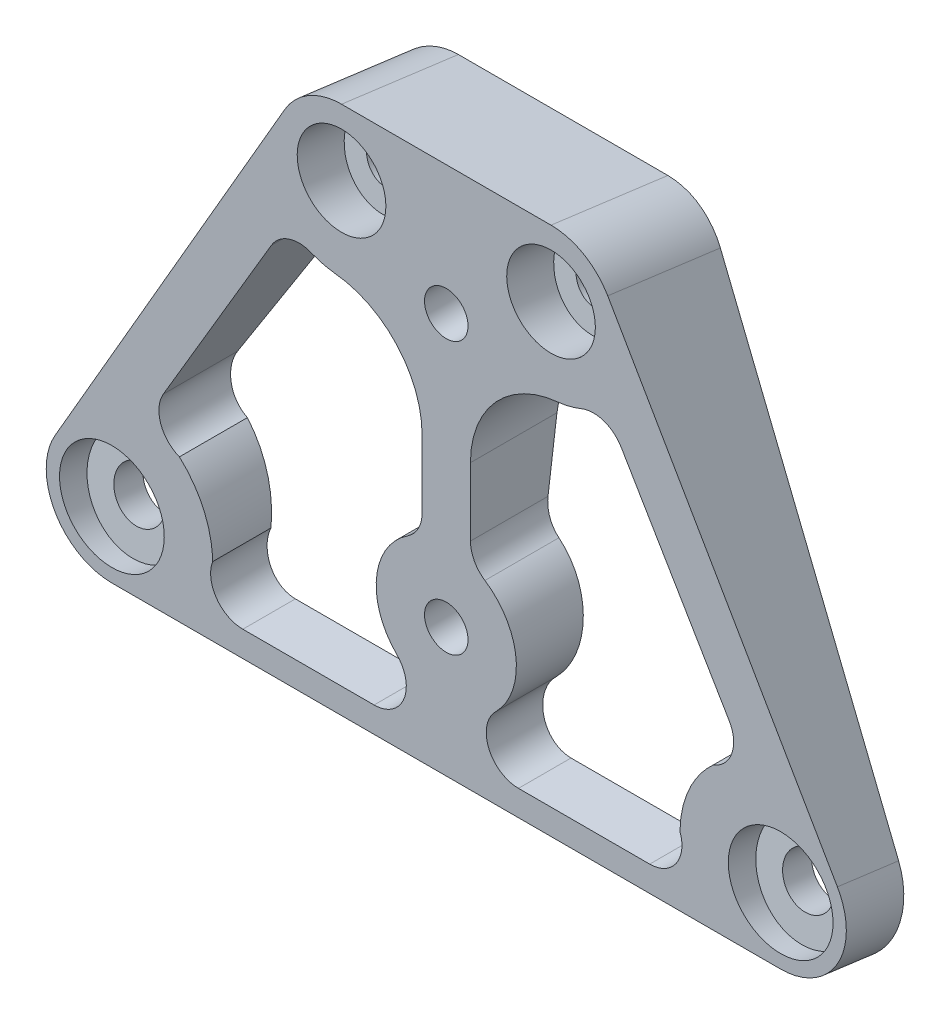
from build123d import *

# Parameters (mm, degrees)
BOSS_EXTRUDE1_REACH              = 47.134
SKETCH1_R                        = 1.375
SKETCH1_R_2                      = 1.575
CBORE_FOR_M3_SHCS1_D             = 3.2
CBORE_FOR_M3_SHCS1_CBORE_D       = 6.5
CBORE_FOR_M3_SHCS1_CBORE_DEPTH   = 5.5
CBORE_FOR_M2_5_SHCS2_D           = 2.7
CBORE_FOR_M2_5_SHCS2_CBORE_D     = 5.5
CBORE_FOR_M2_5_SHCS2_CBORE_DEPTH = 3.5
CBORE_FOR_M2_5_SHCS1_D           = 2.7
CBORE_FOR_M2_5_SHCS1_CBORE_D     = 5.5
CBORE_FOR_M2_5_SHCS1_CBORE_DEPTH = 5
CUT_EXTRUDE2_DEPTH               = 43.124845356


with BuildPart() as part:
    # Boss-Extrude1: up to this plane
    boss_extrude1_end = Plane(origin=(0, 0, 3), z_dir=(0, 0, 1))
    # Sketch1 → Boss-Extrude1 (new, up to the surface)
    with BuildSketch(Plane(origin=(0, 0, 0), x_dir=(1, 0, 0), z_dir=(0, 0.13052619222005188, 0.9914448613738104)), mode=Mode.PRIVATE) as boss_extrude1_sk1:
        with BuildLine():
            Line((0, 28.5), (0, 0))
            Line((0, 0), (20.75, 0))
            ThreePointArc((20.75, 0), (24.283668849, 2.045514976), (24.269768349, 6.128498422))
            Line((24.269768349, 6.128498422), (10.019768349, 30.553498422))
            ThreePointArc((10.019768349, 30.553498422), (8.529485024, 32.033668849), (6.5, 32.575))
            Line((6.5, 32.575), (0, 32.575))
            Line((0, 32.575), (0, 28.5))
        make_face()
        with Locations((6.5, 28.5)):
            Circle(SKETCH1_R, mode=Mode.SUBTRACT)
        with Locations((20.75, 4.075)):
            Circle(SKETCH1_R_2, mode=Mode.SUBTRACT)
    boss_extrude1_tool1 = split(extrude(boss_extrude1_sk1.sketch, amount=BOSS_EXTRUDE1_REACH, mode=Mode.PRIVATE), bisect_by=boss_extrude1_end, keep=Keep.BOTH, mode=Mode.PRIVATE)
    add(boss_extrude1_tool1.solids().sort_by_distance((9.577344, 13.541974, -1.782835))[0])

    # CBORE for M3 SHCS1 (through all)
    with Locations(Plane(origin=(0, 0.954729524, 7.251890712), x_dir=(-1, 0, 0), z_dir=(0, 0.1305261922200519, 0.9914448613738105))):
        with Locations((-20.75, -4.075)):
            CounterBoreHole(CBORE_FOR_M3_SHCS1_D / 2, CBORE_FOR_M3_SHCS1_CBORE_D / 2, CBORE_FOR_M3_SHCS1_CBORE_DEPTH)

    # CBORE for M2.5 SHCS2 (through all)
    with Locations(Plane(origin=(0, 0.954729524, 7.251890712), x_dir=(-1, 0, 0), z_dir=(0, 0.1305261922200519, 0.9914448613738105))):
        with Locations((-6.5, -28.5)):
            CounterBoreHole(CBORE_FOR_M2_5_SHCS2_D / 2, CBORE_FOR_M2_5_SHCS2_CBORE_D / 2, CBORE_FOR_M2_5_SHCS2_CBORE_DEPTH)

    # Mirror1: part across plane


with BuildPart() as part_1:
    add(part.part)
    add(part.part.mirror(Plane(origin=(0, 0, 0), x_dir=(0, 0, 1), z_dir=(1, 0, 0))))

    # CBORE for M2.5 SHCS1 (through all)
    with Locations(Plane(origin=(0, 0, -4.251890712), x_dir=(1, 0, 0), z_dir=(0, 0, -1))):
        with Locations((0, -25.251045884), (0, -8.394957493)):
            CounterBoreHole(CBORE_FOR_M2_5_SHCS1_D / 2, CBORE_FOR_M2_5_SHCS1_CBORE_D / 2, CBORE_FOR_M2_5_SHCS1_CBORE_DEPTH)

    # Sketch23 → Cut-Extrude2 (cut, through all)
    with BuildSketch(Plane.XY.offset(3)):
        with BuildLine():
            Line((12.623790508, 1.975153321), (4.480234369, 1.975153321))
            ThreePointArc((4.480234369, 1.975153321), (2.631634132, 3.211820389), (3.06913693, 5.392476156))
            ThreePointArc((3.06913693, 5.392476156), (4.328394301, 8.908169224), (2.397637796, 12.104730845))
            ThreePointArc((2.397637796, 12.104730845), (1.738647621, 12.826064632), (1.5, 13.773502121))
            Line((1.5, 13.773502121), (1.5, 17.985353527))
            ThreePointArc((1.5, 17.985353527), (3.063849532, 22.025225929), (6.940189675, 23.95918081))
            add(Edge.make_bspline(
                [(6.940189675, 23.95918081), (7.143604146, 23.981751029), (7.344683783, 24.016038635), (7.816288161, 24.124484553), (8.087087758, 24.209901876), (8.34862861, 24.315832383)],
                knots=[0.012994592, 0.012994592, 0.012994592, 0.012994592, 0.03125, 0.03125, 0.056300514, 0.056300514, 0.056300514, 0.056300514], degree=3))
            ThreePointArc((8.34862861, 24.315832383), (9.755972375, 24.375542014), (10.853622853, 23.492736744))
            Line((10.853622853, 23.492736744), (17.554812696, 12.149159325))
            ThreePointArc((17.554812696, 12.149159325), (17.723323038, 10.479170001), (16.560336213, 9.268913106))
            add(Edge.make_bspline(
                [(16.560336213, 9.268913106), (16.480857204, 9.196624751), (16.403239059, 9.122286883), (16.039402336, 8.755578367), (15.775927636, 8.431934638), (15.323177175, 7.748349007), (15.13178367, 7.387522034), (14.897329537, 6.817641357), (14.827739454, 6.621790337), (14.70905517, 6.227430948), (14.65970092, 6.02861076), (14.54474316, 5.446923453), (14.504405456, 5.059906471), (14.500341277, 4.666931627)],
                knots=[0.616779988, 0.616779988, 0.616779988, 0.616779988, 0.625, 0.625, 0.65625, 0.65625, 0.6875, 0.6875, 0.703125, 0.703125, 0.71875, 0.71875, 0.748473893, 0.748473893, 0.748473893, 0.748473893], degree=3))
            ThreePointArc((14.500341277, 4.666931627), (14.264454492, 2.831378127), (12.623790508, 1.975153321))
        make_face()
    cut_extrude2 = extrude(amount=-CUT_EXTRUDE2_DEPTH, mode=Mode.SUBTRACT)

    # Mirror2: Cut-Extrude2 across plane
    add(cut_extrude2.mirror(Plane(origin=(0, 0, 0), x_dir=(0, 0, 1), z_dir=(1, 0, 0))), mode=Mode.SUBTRACT)


solid = part_1.part
